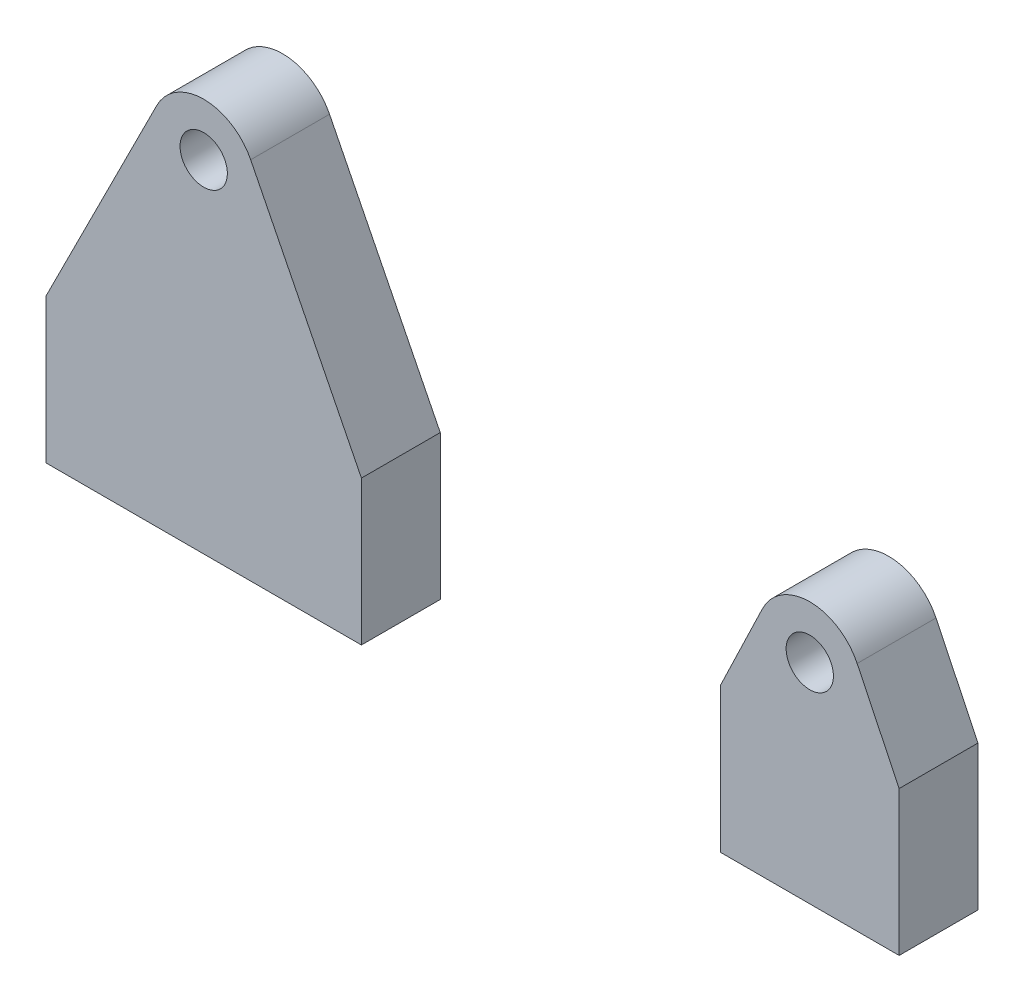
from build123d import *

# Parameters (mm, degrees)
BOSS_EXTRUDE1_DEPTH   = 15
BOSS_EXTRUDE1_2_DEPTH = 15


with BuildPart() as part:
    # Sketch3 → Boss-Extrude1 (new body)
    with BuildSketch(Plane(origin=(0, 0, -60), x_dir=(-1, 0, 0), z_dir=(0, 0, -1))):
        with BuildLine():
            Line((581.302714664, -553.340939136), (560.237622535, -511.429916687))
            ThreePointArc((560.237622535, -511.429916687), (551.302714664, -505.920731906), (542.367806792, -511.429916687))
            Line((542.367806792, -511.429916687), (521.302714664, -553.340939136))
            Line((521.302714664, -553.340939136), (521.302714664, -580.840939136))
            Line((521.302714664, -580.840939136), (581.302714664, -580.840939136))
            Line((581.302714664, -580.840939136), (581.302714664, -553.340939136))
        make_face()
        with BuildLine():
            add(Edge.make_bspline(
                [(555.699368258, -514.961859042), (553.78162253, -506.168551853), (544.98831534, -508.086297582), (546.906061069, -516.879604771), (548.823806798, -525.67291196), (557.617113987, -523.755166231), (555.699368258, -514.961859042)],
                knots=[0, 0, 0, 0, 0.5, 0.5, 0.5, 1, 1, 1, 1], degree=3, weights=[1, 0.333333333, 0.333333333, 1, 0.333333333, 0.333333333, 1]))
        make_face(mode=Mode.SUBTRACT)
    extrude(amount=BOSS_EXTRUDE1_DEPTH)


with BuildPart() as body_2:
    # Sketch3 → Boss-Extrude1 2 (new body)
    with BuildSketch(Plane(origin=(0, 0, -60), x_dir=(-1, 0, 0), z_dir=(0, 0, -1))):
        with BuildLine():
            Line((453.012687074, -553.340939136), (445.024731197, -536.730703811))
            ThreePointArc((445.024731197, -536.730703811), (436.012687074, -531.064646672), (427.000642951, -536.730703811))
            Line((427.000642951, -536.730703811), (419.012687074, -553.340939136))
            Line((419.012687074, -553.340939136), (419.012687074, -580.840939136))
            Line((419.012687074, -580.840939136), (453.012687074, -580.840939136))
            Line((453.012687074, -580.840939136), (453.012687074, -553.340939136))
        make_face()
        with BuildLine():
            add(Edge.make_bspline(
                [(440.409340668, -540.105773808), (438.49159494, -531.312466619), (429.698287751, -533.230212348), (431.616033479, -542.023519537), (433.533779208, -550.816826726), (442.327086397, -548.899080997), (440.409340668, -540.105773808)],
                knots=[0, 0, 0, 0, 0.5, 0.5, 0.5, 1, 1, 1, 1], degree=3, weights=[1, 0.333333333, 0.333333333, 1, 0.333333333, 0.333333333, 1]))
        make_face(mode=Mode.SUBTRACT)
    extrude(amount=BOSS_EXTRUDE1_2_DEPTH)


solid = Compound([part.part, body_2.part])
